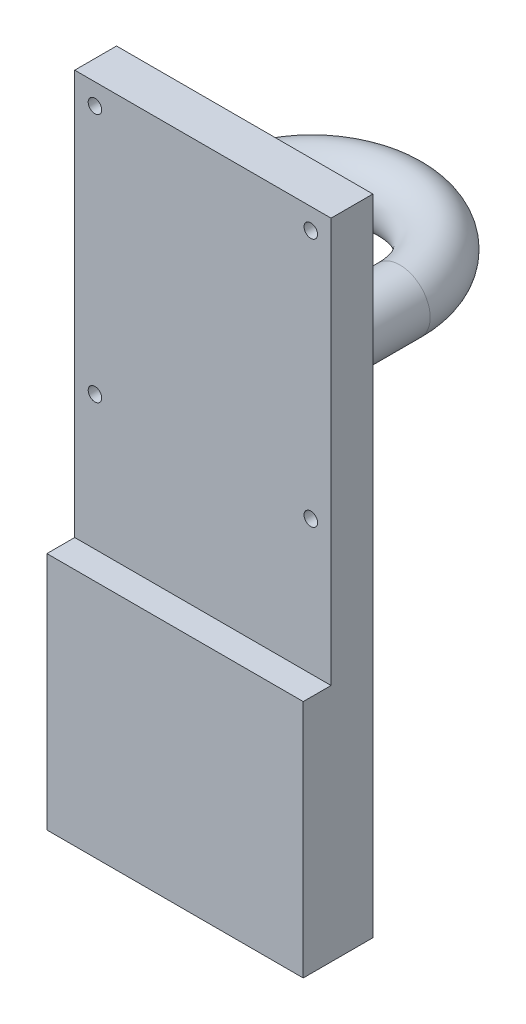
from build123d import *

# Parameters (mm, degrees)
ESQUISSE1_W             = 190
ESQUISSE1_H             = 300
BOSS_EXTRU_1_DEPTH      = 31
ESQUISSE2_R             = 5
ENL_V_MAT_EXTRU_1_DEPTH = 357.456168413
ESQUISSE3_W             = 190
ESQUISSE3_H             = 51.62
BOSS_EXTRU_2_DEPTH      = 177.45
ESQUISSE4_R             = 22.5
BOSS_EXTRU_3_DEPTH      = 50
ESQUISSE5_R             = 22.5
R_VOLUTION1_ANGLE       = 180


with BuildPart() as part:
    # Esquisse1 → Boss.-Extru.1 (new body)
    with BuildSketch(Plane.XY):
        with Locations((95, 150)):
            Rectangle(ESQUISSE1_W, ESQUISSE1_H)
    extrude(amount=BOSS_EXTRU_1_DEPTH)

    # Esquisse2 → Enlèv. mat.-Extru.1 (cut, through all)
    with BuildSketch(Plane(origin=(0, 0, 0), x_dir=(-1, 0, 0), z_dir=(0, 0, -1))):
        with Locations((-175, 284.5)):
            Circle(ESQUISSE2_R)
        with Locations((-15, 284.5)):
            Circle(ESQUISSE2_R)
        with Locations((-175, 99.5)):
            Circle(ESQUISSE2_R)
        with Locations((-15, 99.5)):
            Circle(ESQUISSE2_R)
    extrude(amount=-ENL_V_MAT_EXTRU_1_DEPTH, mode=Mode.SUBTRACT)

    # Esquisse3 → Boss.-Extru.2 (add)
    with BuildSketch(Plane.XZ):
        with Locations((95, 25.81)):
            Rectangle(ESQUISSE3_W, ESQUISSE3_H)
    extrude(amount=BOSS_EXTRU_2_DEPTH)

    # Esquisse4 → Boss.-Extru.3 (add)
    with BuildSketch(Plane(origin=(0, 0, 0), x_dir=(-1, 0, 0), z_dir=(0, 0, -1))):
        with Locations((-160, 192)):
            Circle(ESQUISSE4_R)
        with Locations((-30, 192)):
            Circle(ESQUISSE4_R)
    extrude(amount=BOSS_EXTRU_3_DEPTH)

    # Esquisse5 → Révolution1 (revolve)
    with BuildSketch(Plane(origin=(0, 0, -50), x_dir=(-1, 0, 0), z_dir=(0, 0, -1))):
        with Locations((-160, 192)):
            Circle(ESQUISSE5_R)
    revolve(axis=Axis((95, -797.488132584, -50), (0, 1, 0)), revolution_arc=R_VOLUTION1_ANGLE)


solid = part.part
